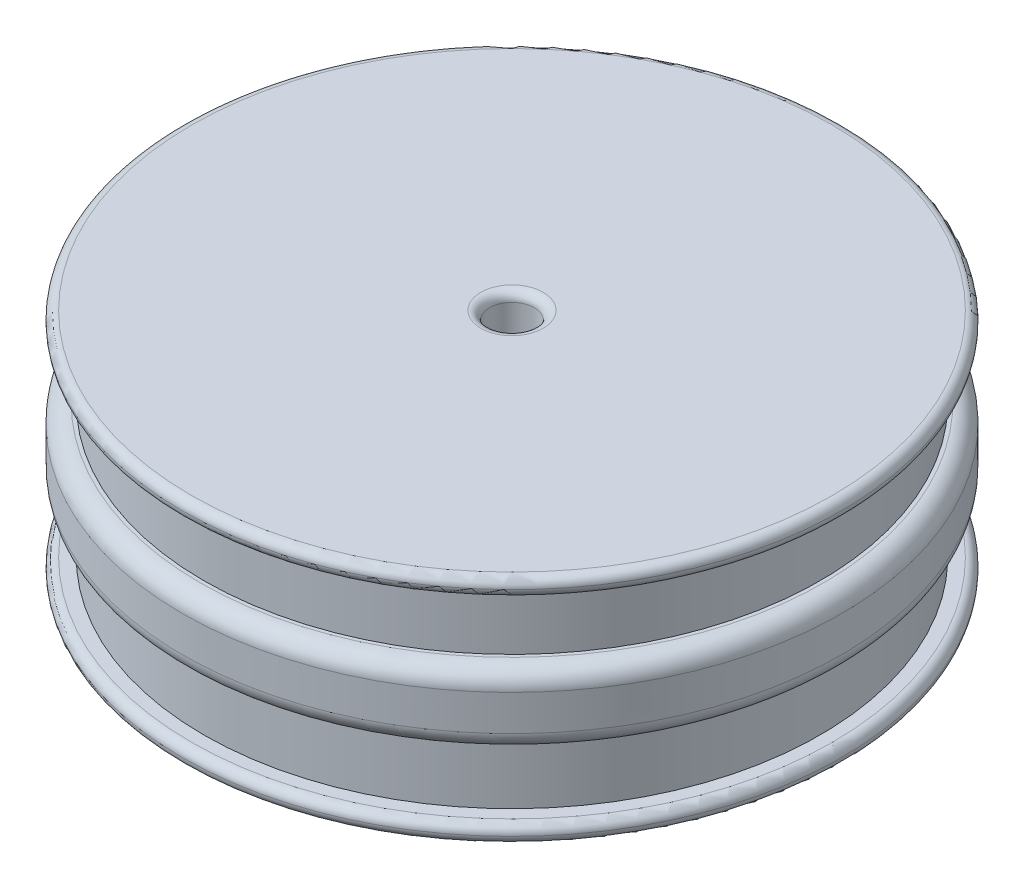
from build123d import *

# Parameters (mm, degrees)
SKETCH1_R           = 18.5
SKETCH1_R_2         = 1.25
BOSS_EXTRUDE1_DEPTH = 13
SKETCH3_W           = 1.2
SKETCH3_H           = 3.5
FILLET1_R           = 1
FILLET2_R           = 0.5
FILLET3_R           = 0.5
FILLET4_R           = 0.5


with BuildPart() as part:
    # Sketch1 → Boss-Extrude1 (new body)
    with BuildSketch(Plane(origin=(0, 0, 0), x_dir=(1, 0, 0), z_dir=(0, 1, 0))):
        with Locations(Location((0, 0, 0), (0, 0, 90))):
            Circle(SKETCH1_R)
        with Locations(Location((0, 0, 0), (0, 0, 90))):
            Circle(SKETCH1_R_2, mode=Mode.SUBTRACT)
    extrude(amount=BOSS_EXTRUDE1_DEPTH)

    # Sketch3 → Cut-Revolve1 (revolve, cut)
    with BuildSketch(Plane(origin=(0, 0, 0), x_dir=(0, 0, -1), z_dir=(1, 0, 0)), mode=Mode.PRIVATE) as cut_revolve1_sk:
        with Locations((-17.9, 10.25)):
            Rectangle(SKETCH3_W, SKETCH3_H)
        with Locations((-17.9, 2.75)):
            Rectangle(SKETCH3_W, SKETCH3_H)
    revolve(cut_revolve1_sk.sketch.rotate(Axis((0, -0.54344918, 0), (0, 1, 0)), 180), axis=Axis((0, -0.54344918, 0), (0, 1, 0)), mode=Mode.SUBTRACT)

    # Fillet1
    fillet1_edges = [part.edges().sort_by_distance(p)[0] for p in [
        (0, 8.5, 18.5),
        (0, 4.5, 18.5),
    ]]
    fillet(fillet1_edges, radius=FILLET1_R)

    # Fillet2
    fillet2_edges = [part.edges().sort_by_distance(p)[0] for p in [
        (0, 12, 18.5),
        (0, 1, 18.5),
    ]]
    fillet(fillet2_edges, radius=FILLET2_R)

    # Fillet3
    fillet3_edges = [part.edges().sort_by_distance(p)[0] for p in [
        (0, 0, 18.5),
        (0, 13, 18.5),
    ]]
    fillet(fillet3_edges, radius=FILLET3_R - 0.0001)  # a hair under: the kernel refuses the full size

    # Fillet4
    fillet4_edges = [part.edges().sort_by_distance(p)[0] for p in [
        (0, 0, 1.25),
        (0, 13, 1.25),
    ]]
    fillet(fillet4_edges, radius=FILLET4_R)


solid = part.part
